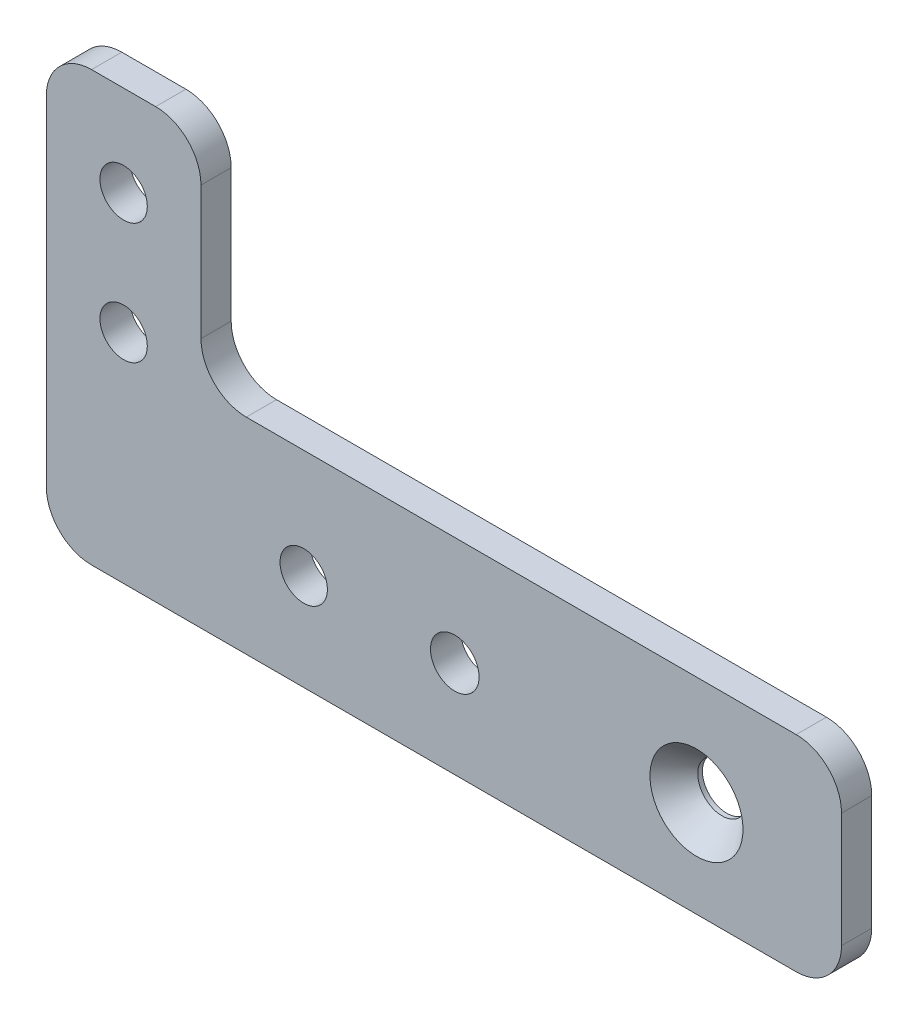
from build123d import *

# Parameters (mm, degrees)
SKETCH1_R                                       = 2.4892
SKETCH1_R_2                                     = 2.5527
BOSS_EXTRUDE1_DEPTH                             = 3.175
FILLET1_R                                       = 4.7625
CSK_FOR_10_FLAT_HEAD_MACHINE_SCREW1_D           = 5.1054
CSK_FOR_10_FLAT_HEAD_MACHINE_SCREW1_DEPTH       = 19.05
CSK_FOR_10_FLAT_HEAD_MACHINE_SCREW1_CSINK_D     = 9.779
CSK_FOR_10_FLAT_HEAD_MACHINE_SCREW1_CSINK_ANGLE = 82
CSK_FOR_10_FLAT_HEAD_MACHINE_SCREW1_TIP         = 1.533816902


with BuildPart() as part:
    # Sketch1 → Boss-Extrude1 (new body)
    with BuildSketch(Plane.XY):
        Polygon((-37.846, 23.8125), (-37.846, -21.2725), (45.72, -21.2725), (45.72, 0.3175), (-21.59, 0.3175), (-21.59, 23.8125), align=None)
        with Locations((-10.795, -11.1125)):
            Circle(SKETCH1_R, mode=Mode.SUBTRACT)
        with Locations((5.08, -11.1125)):
            Circle(SKETCH1_R_2, mode=Mode.SUBTRACT)
        with Locations((30.48, -11.1125)):
            Circle(SKETCH1_R_2, mode=Mode.SUBTRACT)
        with Locations((-29.718, 1.5875)):
            Circle(SKETCH1_R, mode=Mode.SUBTRACT)
        with Locations((-29.718, 14.2875)):
            Circle(SKETCH1_R, mode=Mode.SUBTRACT)
    extrude(amount=BOSS_EXTRUDE1_DEPTH)

    # Fillet1
    fillet1_edges = [part.edges().sort_by_distance(p)[0] for p in [
        (-37.846, 23.8125, 1.5875),
        (-21.59, 23.8125, 1.5875),
        (-21.59, 0.3175, 1.5875),
        (45.72, 0.3175, 1.5875),
        (45.72, -21.2725, 1.5875),
        (-37.846, -21.2725, 1.5875),
    ]]
    fillet(fillet1_edges, radius=FILLET1_R)

    # CSK for #10 Flat Head Machine Screw1
    with Locations(Plane.XY.offset(3.175)):
        with Locations((30.48, -11.1125)):
            CounterSinkHole(CSK_FOR_10_FLAT_HEAD_MACHINE_SCREW1_D / 2, CSK_FOR_10_FLAT_HEAD_MACHINE_SCREW1_CSINK_D / 2, depth=CSK_FOR_10_FLAT_HEAD_MACHINE_SCREW1_DEPTH, counter_sink_angle=CSK_FOR_10_FLAT_HEAD_MACHINE_SCREW1_CSINK_ANGLE)
            with Locations((0, 0, -(CSK_FOR_10_FLAT_HEAD_MACHINE_SCREW1_DEPTH + CSK_FOR_10_FLAT_HEAD_MACHINE_SCREW1_TIP / 2))):  # 118° drill point
                Cone(0, CSK_FOR_10_FLAT_HEAD_MACHINE_SCREW1_D / 2, CSK_FOR_10_FLAT_HEAD_MACHINE_SCREW1_TIP, mode=Mode.SUBTRACT)


solid = part.part
